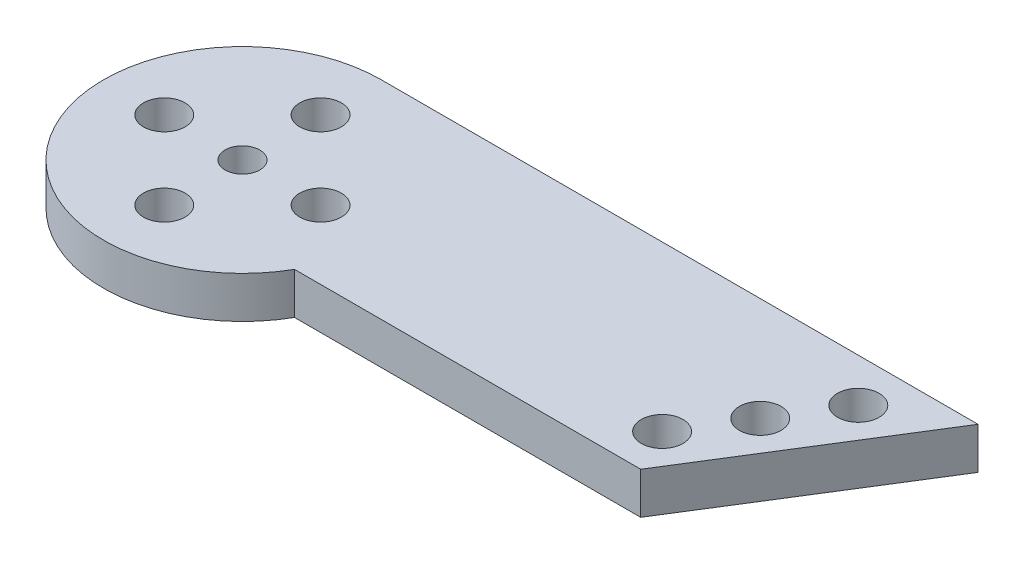
from build123d import *

# Parameters (mm, degrees)
SKETCH1_R           = 1.2
SKETCH1_R_2         = 1
BOSS_EXTRUDE1_DEPTH = 2.4
CUT_EXTRUDE1_DEPTH  = 24.69949444


with BuildPart() as part:
    # Sketch1 → Boss-Extrude1 (new body)
    with BuildSketch(Plane(origin=(0, 0, 0), x_dir=(1, 0, 0), z_dir=(0, 1, 0))):
        with BuildLine():
            Line((-12.181045185, 8), (22.178954815, 8))
            Line((22.178954815, 8), (12.181045185, -8))
            Line((12.181045185, -8), (-12.181045185, -8))
            ThreePointArc((-12.181045185, -8), (-20.181045185, 0), (-12.181045185, 8))
        make_face()
        with Locations((-12.181045185, 4.5)):
            Circle(SKETCH1_R, mode=Mode.SUBTRACT)
        with Locations((-7.681045185, 0)):
            Circle(SKETCH1_R, mode=Mode.SUBTRACT)
        with Locations((-12.181045185, -4.5)):
            Circle(SKETCH1_R, mode=Mode.SUBTRACT)
        with Locations((-16.681045185, 0)):
            Circle(SKETCH1_R, mode=Mode.SUBTRACT)
        with Locations((17.786753267, 5.5)):
            Circle(SKETCH1_R, mode=Mode.SUBTRACT)
        with Locations((13.441415301, -1.453994388)):
            Circle(SKETCH1_R, mode=Mode.SUBTRACT)
        with Locations((15.614084284, 2.023002806)):
            Circle(SKETCH1_R, mode=Mode.SUBTRACT)
        with Locations((-12.181045185, 0)):
            Circle(SKETCH1_R_2, mode=Mode.SUBTRACT)
    extrude(amount=BOSS_EXTRUDE1_DEPTH)

    # Sketch2 → Cut-Extrude1 (cut, through all)
    with BuildSketch(Plane(origin=(0, 2.4, 0), x_dir=(1, 0, 0), z_dir=(0, 1, 0))):
        with BuildLine():
            Line((14.709270089, -3.953994388), (-5.226483489, -3.953994388))
            ThreePointArc((-5.226483489, -3.953994388), (-8.158108142, -6.914909801), (-12.181045185, -8))
            Line((-12.181045185, -8), (12.181045185, -8))
            Line((12.181045185, -8), (14.709270089, -3.953994388))
        make_face()
    extrude(amount=-CUT_EXTRUDE1_DEPTH, mode=Mode.SUBTRACT)


solid = part.part
